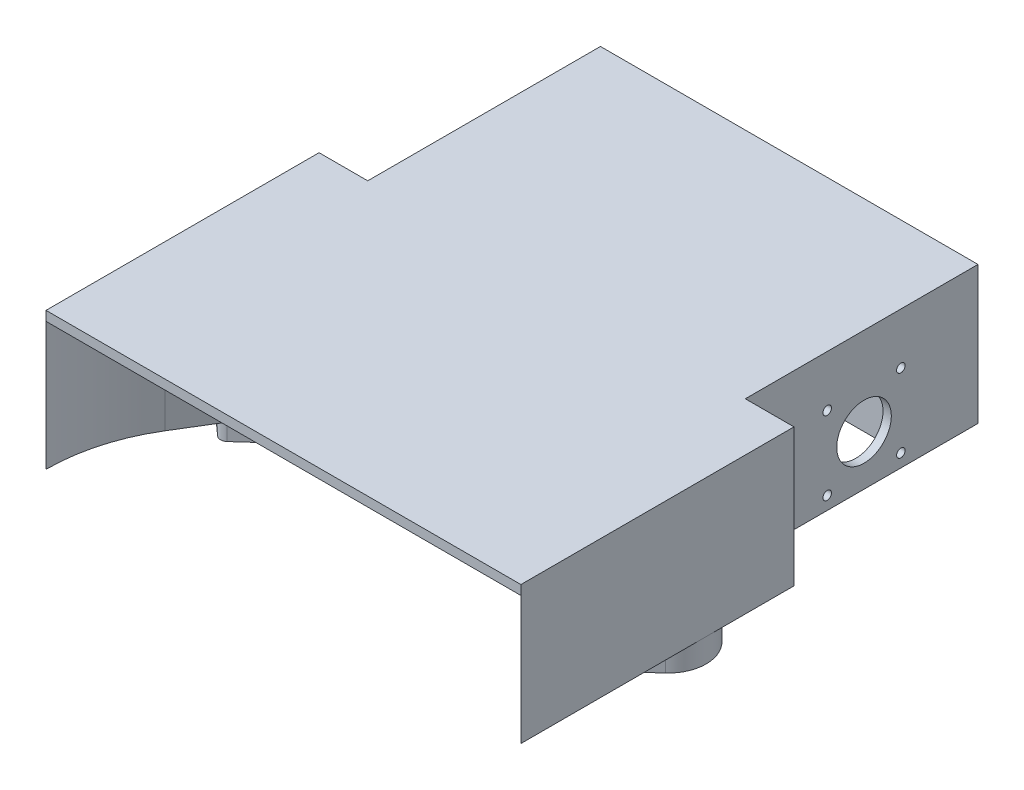
from build123d import *

# Parameters (mm, degrees)
SKETCH_1_W              = 200
SKETCH_1_H              = 213
EXTRUDE_1_DEPTH         = 4
EXTRUDE_2_DEPTH         = 54
CUT_EXTRUDE_2_DEPTH     = 298.880848663
CUT_EXTRUDE_3_DEPTH     = 42
SKETCH_7_R              = 1.8
SKETCH_7_R_2            = 11.5
CUT_EXTRUDE_4_DEPTH     = 282.53330176
MIRROR_START            = 176
MIRROR_1_OUTLINE_R      = 1.8
MIRROR_1_OUTLINE_R_2    = 11.5
MIRROR_1_DEPTH          = 3.5
CUT_EXTRUDE_START       = -21
CUT_EXTRUDE_5_OUTLINE_W = 27
CUT_EXTRUDE_5_OUTLINE_H = 20
CUT_EXTRUDE_5_DEPTH     = 21
CUT_EXTRUDE_START_2     = -6
CUT_EXTRUDE_6_OUTLINE_W = 27
CUT_EXTRUDE_6_OUTLINE_H = 28
CUT_EXTRUDE_6_DEPTH     = 6
CUT_EXTRUDE_START_3     = -54
CUT_EXTRUDE_7_DEPTH     = 54
SKETCH_12_R             = 2
EXTRUDE_3_DEPTH         = 10


# Read off the part's stored shape, not the designer's step: 镜向1, 切除-拉伸5, 切除-拉伸6
with BuildPart() as part:
    # 草图1 → 凸台-拉伸1 (new body)
    with BuildSketch(Plane(origin=(0, 0, 0), x_dir=(1, 0, 0), z_dir=(0, 1, 0))):
        with Locations((100, 106.5)):
            Rectangle(SKETCH_1_W, SKETCH_1_H)
    extrude(amount=EXTRUDE_1_DEPTH)

    # 草图1<4> → 凸台-拉伸2 (add)
    with BuildSketch(Plane(origin=(0, 0, 0), x_dir=(1, 0, 0), z_dir=(0, 1, 0))):
        with BuildLine():
            Line((0, 213), (0, 0))
            ThreePointArc((0, 0), (21.966991411, 53.033008589), (75, 75))
            Line((75, 75), (75, 213))
            Line((75, 213), (0, 213))
        make_face()
        with BuildLine():
            Line((125, 213), (125, 75))
            ThreePointArc((125, 75), (178.033008589, 53.033008589), (200, 0))
            Line((200, 0), (200, 213))
            Line((200, 213), (125, 213))
        make_face()
    extrude(amount=-EXTRUDE_2_DEPTH)

    # 草图3 → 切除-拉伸2 (cut, through all)
    with BuildSketch(Plane.XZ.offset(54)):
        Polygon((20.5, -186), (20.5, -165), (20.5, -144), (20.5, -115), (0, -115), (0, -213), (20.5, -213), align=None)
        Polygon((179.5, -115), (200, -115), (200, -213), (179.5, -213), (179.5, -165), align=None)
    extrude(amount=-CUT_EXTRUDE_2_DEPTH, mode=Mode.SUBTRACT)

    # 草图5 → 切除-拉伸3 (cut)
    with BuildSketch(Plane.XZ.offset(54)):
        Polygon((176, -164), (176, -144), (125, -144), (125, -186), (176, -186), align=None)
        Polygon((24, -164), (24, -144), (75, -144), (75, -186), (24, -186), align=None)
    extrude(amount=-CUT_EXTRUDE_3_DEPTH, mode=Mode.SUBTRACT)

    # 草图7 → 切除-拉伸4 (cut, through all)
    with BuildSketch(Plane(origin=(24, 0, 0), x_dir=(0, 0, -1), z_dir=(1, 0, 0))):
        with Locations((180.5, -17.5)):
            Circle(SKETCH_7_R)
        with Locations((149.5, -17.5)):
            Circle(SKETCH_7_R)
        with Locations((165, -33)):
            Circle(SKETCH_7_R_2)
        with Locations((180.5, -48.5)):
            Circle(SKETCH_7_R)
        with Locations((149.5, -48.5)):
            Circle(SKETCH_7_R)
    extrude(amount=-CUT_EXTRUDE_4_DEPTH, mode=Mode.SUBTRACT)

    # 镜向1 outline → 镜向1 (cut)
    with BuildSketch(Plane.YZ.offset(MIRROR_START)):
        with Locations((-17.5, -180.5)):
            Circle(MIRROR_1_OUTLINE_R)
        with Locations((-17.5, -149.5)):
            Circle(MIRROR_1_OUTLINE_R)
        with Locations((-33, -165)):
            Circle(MIRROR_1_OUTLINE_R_2)
        with Locations((-48.5, -180.5)):
            Circle(MIRROR_1_OUTLINE_R)
        with Locations((-48.5, -149.5)):
            Circle(MIRROR_1_OUTLINE_R)
    extrude(amount=MIRROR_1_DEPTH, mode=Mode.SUBTRACT)

    # 切除-拉伸5 outline → 切除-拉伸5 (cut)
    with BuildSketch(Plane(origin=(75, 0, 0), x_dir=(0, 0, -1), z_dir=(1, 0, 0)).offset(CUT_EXTRUDE_START)):
        with Locations((199.5, -33)):
            Rectangle(CUT_EXTRUDE_5_OUTLINE_W, CUT_EXTRUDE_5_OUTLINE_H)
    extrude(amount=CUT_EXTRUDE_5_DEPTH, mode=Mode.SUBTRACT)

    # 切除-拉伸6 outline → 切除-拉伸6 (cut)
    with BuildSketch(Plane.ZY.offset(-125).offset(CUT_EXTRUDE_START_2)):
        with Locations((-199.5, -33)):
            Rectangle(CUT_EXTRUDE_6_OUTLINE_W, CUT_EXTRUDE_6_OUTLINE_H)
    extrude(amount=CUT_EXTRUDE_6_DEPTH, mode=Mode.SUBTRACT)

    # 草图11 → 切除-拉伸7 (cut)
    with BuildSketch(Plane.XZ.offset(54).offset(CUT_EXTRUDE_START_3)):
        with BuildLine():
            Line((29.658534166, -69.684244774), (10.975621098, -39.0625))
            ThreePointArc((10.975621098, -39.0625), (38.289562111, -65.401404801), (75, -75))
            Line((75, -75), (75, -144))
            ThreePointArc((75, -144), (37.483837038, -124.777752739), (31.171635941, -83.099060455))
            ThreePointArc((31.171635941, -83.099060455), (31.899182276, -76.224256342), (29.658534166, -69.684244774))
        make_face()
        with BuildLine():
            Line((125, -144), (125, -75))
            ThreePointArc((125, -75), (161.710437889, -65.401404801), (189.024378902, -39.0625))
            Line((189.024378902, -39.0625), (170.341465834, -69.684244774))
            ThreePointArc((170.341465834, -69.684244774), (168.100817724, -76.224256342), (168.828364059, -83.099060455))
            ThreePointArc((168.828364059, -83.099060455), (162.516162962, -124.777752739), (125, -144))
        make_face()
    extrude(amount=CUT_EXTRUDE_7_DEPTH, mode=Mode.SUBTRACT)

    # 草图12 → 凸台-拉伸3 (add)
    # profile 1 of 2: a face of its own
    with BuildSketch(Plane.XZ.offset(54)):
        with BuildLine():
            Line((18.008349917, -58.289006678), (26.711199556, -66.131863821))
            ThreePointArc((26.711199556, -66.131863821), (32, -78.017578107), (26.711199556, -89.903292393))
            Line((26.711199556, -89.903292393), (18.008349917, -97.746149535))
            ThreePointArc((18.008349917, -97.746149535), (16, -98.517578107), (13.991650083, -97.746149535))
            Line((13.991650083, -97.746149535), (5.288800444, -89.903292393))
            ThreePointArc((5.288800444, -89.903292393), (0, -78.017578107), (5.288800444, -66.131863821))
            Line((5.288800444, -66.131863821), (13.991650083, -58.289006678))
            ThreePointArc((13.991650083, -58.289006678), (16, -57.517578107), (18.008349917, -58.289006678))
        make_face()
        with Locations(Location((16, -60.517578107, 0), (0, 0, 270))):
            Circle(SKETCH_12_R, mode=Mode.SUBTRACT)
        with Locations(Location((16, -95.517578107, 0), (0, 0, 90))):
            Circle(SKETCH_12_R, mode=Mode.SUBTRACT)
    # profile 2 of 2: a face of its own
    with BuildSketch(Plane.XZ.offset(54)):
        with BuildLine():
            Line((186.008349917, -97.746149535), (194.711199556, -89.903292393))
            ThreePointArc((194.711199556, -89.903292393), (200, -78.017578107), (194.711199556, -66.131863821))
            Line((194.711199556, -66.131863821), (186.008349917, -58.289006678))
            ThreePointArc((186.008349917, -58.289006678), (184, -57.517578107), (181.991650083, -58.289006678))
            Line((181.991650083, -58.289006678), (173.288800444, -66.131863821))
            ThreePointArc((173.288800444, -66.131863821), (168, -78.017578107), (173.288800444, -89.903292393))
            Line((173.288800444, -89.903292393), (181.991650083, -97.746149535))
            ThreePointArc((181.991650083, -97.746149535), (184, -98.517578107), (186.008349917, -97.746149535))
        make_face()
        with Locations(Location((184, -95.517578107, 0), (0, 0, 270))):
            Circle(SKETCH_12_R, mode=Mode.SUBTRACT)
        with Locations(Location((184, -60.517578107, 0), (0, 0, 90))):
            Circle(SKETCH_12_R, mode=Mode.SUBTRACT)
    extrude(amount=EXTRUDE_3_DEPTH)


solid = part.part
